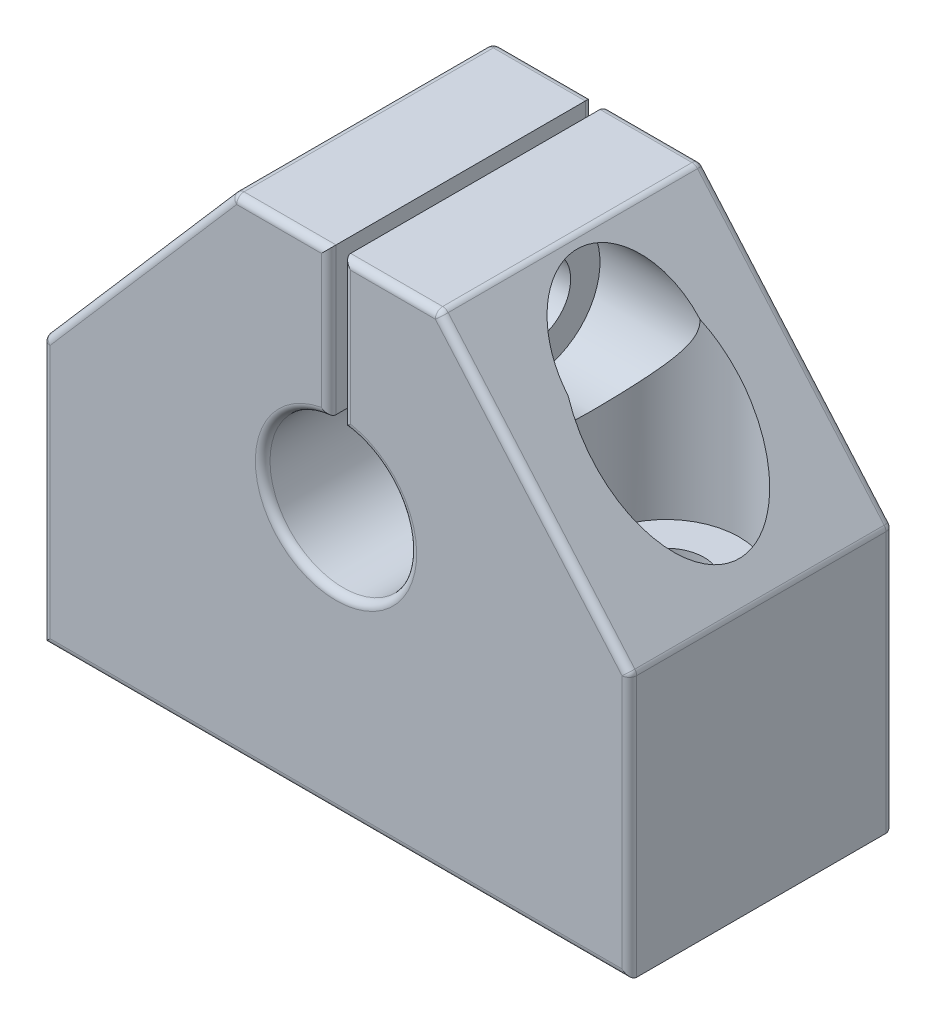
from build123d import *

# Parameters (mm, degrees)
BOSS_EXTRUDE1_DEPTH      = 9
BOSS_EXTRUDE1_DEPTH_BACK = 9
SKETCH2_R                = 5
CUT_EXTRUDE1_DEPTH       = 55.890800686
SKETCH5_R                = 2.6
CUT_EXTRUDE2_DEPTH       = 16
SKETCH7_R                = 5
CUT_EXTRUDE3_DEPTH       = 45.384682042
SKETCH9_W                = 1
SKETCH9_H                = 10.050125628
CUT_EXTRUDE4_DEPTH       = 55.890800686
CUT_EXTRUDE5_DEPTH       = 5
CUT_EXTRUDE5_DEPTH_BACK  = 40.877938763
SKETCH10_R               = 2.5
SKETCH11_R               = 4.5
CUT_EXTRUDE6_DEPTH       = 43.074338973
FILLET1_R                = 0.5


with BuildPart() as part:
    # Sketch1 → Boss-Extrude1 (new, two sides: drawn at the far end of the back side and taken through both)
    with BuildSketch(Plane.XY.offset(-BOSS_EXTRUDE1_DEPTH_BACK)):
        Polygon((0, 0), (40, 0), (40, 18), (27, 33), (13, 33), (0, 18), align=None)
    extrude(amount=BOSS_EXTRUDE1_DEPTH + BOSS_EXTRUDE1_DEPTH_BACK)

    # Sketch2 → Cut-Extrude1 (cut, through all)
    with BuildSketch(Plane.XY.offset(9)):
        with Locations((20, 18)):
            Circle(SKETCH2_R)
    extrude(amount=-CUT_EXTRUDE1_DEPTH, mode=Mode.SUBTRACT)

    # Sketch5 → Cut-Extrude2 (cut)
    with BuildSketch(Plane(origin=(0, 0, 0), x_dir=(-1, 0, 0), z_dir=(0, -1, 0))):
        with Locations((-33.5, 0)):
            Circle(SKETCH5_R)
    cut_extrude2 = extrude(amount=-CUT_EXTRUDE2_DEPTH, mode=Mode.SUBTRACT)

    # Sketch7 → Cut-Extrude3 (cut, through all)
    with BuildSketch(Plane(origin=(0, 16, 0), x_dir=(-1, 0, 0), z_dir=(0, -1, 0))):
        with Locations((-33.5, 0)):
            Circle(SKETCH7_R)
    cut_extrude3 = extrude(amount=-CUT_EXTRUDE3_DEPTH, mode=Mode.SUBTRACT)

    # Mirror1: Cut-Extrude2, Cut-Extrude3 across plane
    add(cut_extrude2.mirror(Plane(origin=(20, 0, 0), x_dir=(0, 0, 1), z_dir=(1, 0, 0))), mode=Mode.SUBTRACT)
    add(cut_extrude3.mirror(Plane(origin=(20, 0, 0), x_dir=(0, 0, 1), z_dir=(1, 0, 0))), mode=Mode.SUBTRACT)

    # Sketch9 → Cut-Extrude4 (cut, through all)
    with BuildSketch(Plane.XY.offset(9)):
        with Locations((20, 28)):
            Rectangle(SKETCH9_W, SKETCH9_H)
    extrude(amount=-CUT_EXTRUDE4_DEPTH, mode=Mode.SUBTRACT)

    # Sketch10 → Cut-Extrude5 (cut, two sides: drawn at the far end of the back side and taken through both)
    with BuildSketch(Plane(origin=(19.5, 0, 0), x_dir=(0, 0, -1), z_dir=(1, 0, 0)).offset(-CUT_EXTRUDE5_DEPTH_BACK)):
        with Locations((0, 27.987468593)):
            Circle(SKETCH10_R)
    extrude(amount=CUT_EXTRUDE5_DEPTH + CUT_EXTRUDE5_DEPTH_BACK, mode=Mode.SUBTRACT)

    # Sketch11 → Cut-Extrude6 (cut, through all)
    with BuildSketch(Plane.ZY.offset(-24.5)):
        with Locations((0, 27.987468593)):
            Circle(SKETCH11_R)
    extrude(amount=-CUT_EXTRUDE6_DEPTH, mode=Mode.SUBTRACT)

    # Fillet1
    fillet1_edges = [part.edges().sort_by_distance(p)[0] for p in [
        (20, 13, -9),
        (19.5, 27.987468593, -9),
        (16.25, 33, -9),
        (6.5, 25.5, -9),
        (0, 9, -9),
        (20, 0, -9),
        (40, 9, -9),
        (33.5, 25.5, -9),
        (23.75, 33, -9),
        (20.5, 27.987468593, -9),
        (33.5, 25.5, 9),
        (40, 9, 9),
        (20, 0, 9),
        (0, 9, 9),
        (6.5, 25.5, 9),
        (16.25, 33, 9),
        (19.5, 27.987468593, 9),
        (20, 13, 9),
        (20.5, 27.987468593, 9),
        (23.75, 33, 9),
        (27, 33, 0),
        (13, 33, 0),
        (0, 18, 0),
        (40, 18, 0),
    ]]
    fillet(fillet1_edges, radius=FILLET1_R)


solid = part.part
